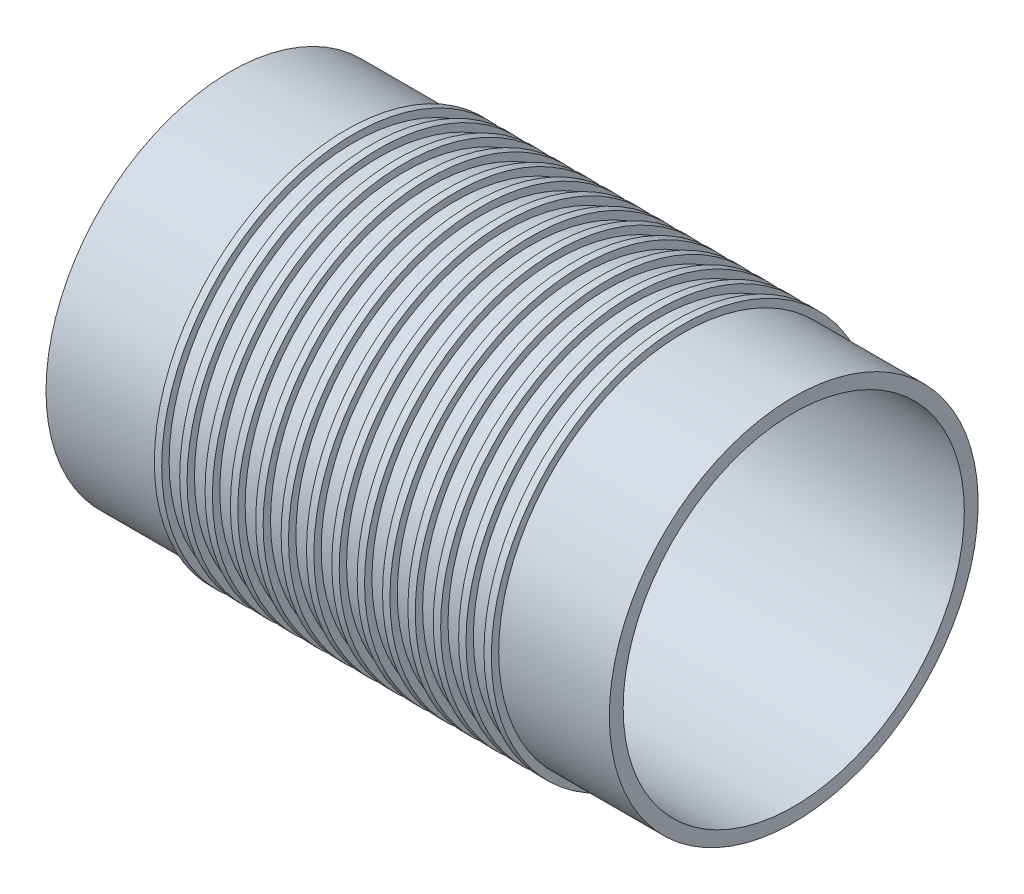
from build123d import *


with BuildPart() as part:
    # Sketch1 → Revolve1 (revolve)
    with BuildSketch(Plane.XY):
        Polygon((-30.55, 18.5), (30.55, 18.5), (30.55, 20), (18.55, 20), (18.55, 20.8), (17.75, 20.8), (17.75, 20), (15.8, 20), (15.8, 20.8), (15, 20.8), (15, 20), (13.05, 20), (13.05, 20.8), (12.25, 20.8), (12.25, 20), (10.3, 20), (10.3, 20.8), (9.5, 20.8), (9.5, 20), (7.55, 20), (7.55, 20.8), (6.75, 20.8), (6.75, 20), (4.8, 20), (4.8, 20.8), (4, 20.8), (4, 20), (2.05, 20), (2.05, 20.8), (1.25, 20.8), (1.25, 20), (-0.7, 20), (-0.7, 20.8), (-1.5, 20.8), (-1.5, 20), (-3.45, 20), (-3.45, 20.8), (-4.25, 20.8), (-4.25, 20), (-6.2, 20), (-6.2, 20.8), (-7, 20.8), (-7, 20), (-8.95, 20), (-8.95, 20.8), (-9.75, 20.8), (-9.75, 20), (-11.7, 20), (-11.7, 20.8), (-12.5, 20.8), (-12.5, 20), (-14.45, 20), (-14.45, 20.8), (-15.25, 20.8), (-15.25, 20), (-17.2, 20), (-17.2, 20.8), (-18, 20.8), (-18, 20), (-30.55, 20), align=None)
    revolve(axis=Axis((-100.187905083, 0, 0), (1, 0, 0)))


solid = part.part
